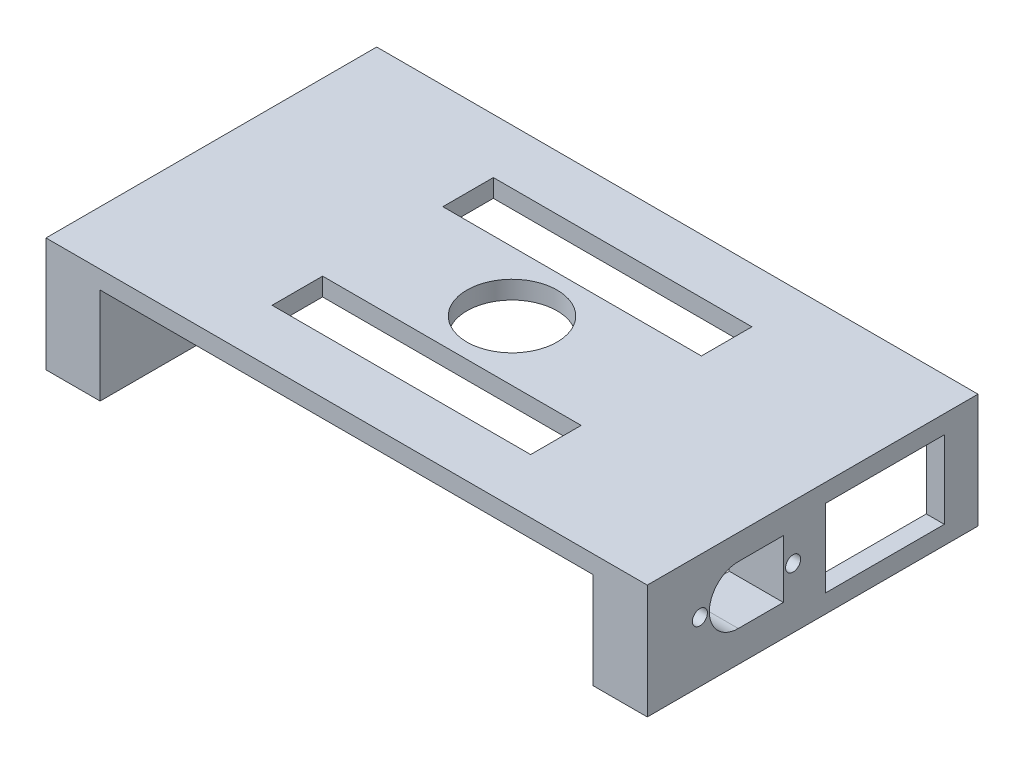
from build123d import *

# Parameters (mm, degrees)
SKETCH1_W           = 100
SKETCH1_H           = 55
BOSS_EXTRUDE1_DEPTH = 19
SKETCH2_W           = 82
SKETCH2_H           = 91
CUT_EXTRUDE1_DEPTH  = 16
CUT_EXTRUDE3_REACH  = 107.438
SKETCH3_R           = 1.25
CUT_EXTRUDE13_REACH = 107.438
SKETCH15_W          = 19.8
SKETCH15_H          = 12.9
CUT_EXTRUDE14_REACH = 62.144
SKETCH6_R           = 7.5
SKETCH6_W           = 43
SKETCH6_H           = 8.4
SKETCH16_W          = 6
SKETCH16_H          = 27.5
CUT_EXTRUDE15_DEPTH = 16


with BuildPart() as part:
    # Sketch1 → Boss-Extrude1 (new body)
    with BuildSketch(Plane(origin=(0, 0, 0), x_dir=(1, 0, 0), z_dir=(0, 1, 0))):
        Rectangle(SKETCH1_W, SKETCH1_H)
    extrude(amount=BOSS_EXTRUDE1_DEPTH)

    # Sketch2 → Cut-Extrude1 (cut)
    with BuildSketch(Plane.XZ):
        Rectangle(SKETCH2_W, SKETCH2_H)
    extrude(amount=-CUT_EXTRUDE1_DEPTH, mode=Mode.SUBTRACT)

    # Sketch3 → Cut-Extrude3 (cut, up to next)
    with BuildSketch(Plane(origin=(50, 0, 0), x_dir=(0, 0, -1), z_dir=(1, 0, 0)), mode=Mode.PRIVATE) as cut_extrude3_sk1:
        with Locations((-18.75, 10)):
            Circle(SKETCH3_R)
    cut_extrude3_tool1 = extrude(cut_extrude3_sk1.sketch, amount=-CUT_EXTRUDE3_REACH, mode=Mode.PRIVATE) & part.part
    # Sketch3 → Cut-Extrude3 (cut, up to next)
    with BuildSketch(Plane(origin=(50, 0, 0), x_dir=(0, 0, -1), z_dir=(1, 0, 0)), mode=Mode.PRIVATE) as cut_extrude3_sk2:
        with Locations((-3.25, 10)):
            Circle(SKETCH3_R)
    cut_extrude3_tool2 = extrude(cut_extrude3_sk2.sketch, amount=-CUT_EXTRUDE3_REACH, mode=Mode.PRIVATE) & part.part
    # Sketch3 → Cut-Extrude3 (cut, up to next)
    with BuildSketch(Plane(origin=(50, 0, 0), x_dir=(0, 0, -1), z_dir=(1, 0, 0)), mode=Mode.PRIVATE) as cut_extrude3_sk3:
        with BuildLine():
            Line((-4.871818182, 5.185), (-4.871818182, 14.815))
            Line((-4.871818182, 14.815), (-12.367897727, 14.815))
            ThreePointArc((-12.367897727, 14.815), (-17.182897727, 10), (-12.367897727, 5.185))
            Line((-12.367897727, 5.185), (-4.871818182, 5.185))
        make_face()
    cut_extrude3_tool3 = extrude(cut_extrude3_sk3.sketch, amount=-CUT_EXTRUDE3_REACH, mode=Mode.PRIVATE) & part.part
    add(cut_extrude3_tool1.solids().sort_by_distance((50, 10, 18.75))[0], mode=Mode.SUBTRACT)
    add(cut_extrude3_tool2.solids().sort_by_distance((50, 10, 3.25))[0], mode=Mode.SUBTRACT)
    add(cut_extrude3_tool3.solids().sort_by_distance((50, 10, 10.561909))[0], mode=Mode.SUBTRACT)

    # Sketch15 → Cut-Extrude13 (cut, up to next)
    with BuildSketch(Plane(origin=(50, 0, 0), x_dir=(0, 0, -1), z_dir=(1, 0, 0)), mode=Mode.PRIVATE) as cut_extrude13_sk1:
        with Locations((12, 9.5)):
            Rectangle(SKETCH15_W, SKETCH15_H)
    cut_extrude13_tool1 = extrude(cut_extrude13_sk1.sketch, amount=-CUT_EXTRUDE13_REACH, mode=Mode.PRIVATE) & part.part
    add(cut_extrude13_tool1.solids().sort_by_distance((50, 9.5, -12))[0], mode=Mode.SUBTRACT)

    # Sketch6 → Cut-Extrude14 (cut, up to next)
    with BuildSketch(Plane(origin=(0, 19, 0), x_dir=(1, 0, 0), z_dir=(0, 1, 0)), mode=Mode.PRIVATE) as cut_extrude14_sk1:
        Circle(SKETCH6_R)
    cut_extrude14_tool1 = extrude(cut_extrude14_sk1.sketch, amount=-CUT_EXTRUDE14_REACH, mode=Mode.PRIVATE) & part.part
    # Sketch6 → Cut-Extrude14 (cut, up to next)
    with BuildSketch(Plane(origin=(0, 19, 0), x_dir=(1, 0, 0), z_dir=(0, 1, 0)), mode=Mode.PRIVATE) as cut_extrude14_sk2:
        with Locations((0, -14.2)):
            Rectangle(SKETCH6_W, SKETCH6_H)
    cut_extrude14_tool2 = extrude(cut_extrude14_sk2.sketch, amount=-CUT_EXTRUDE14_REACH, mode=Mode.PRIVATE) & part.part
    # Sketch6 → Cut-Extrude14 (cut, up to next)
    with BuildSketch(Plane(origin=(0, 19, 0), x_dir=(1, 0, 0), z_dir=(0, 1, 0)), mode=Mode.PRIVATE) as cut_extrude14_sk3:
        with Locations((0, 14.2)):
            Rectangle(SKETCH6_W, SKETCH6_H)
    cut_extrude14_tool3 = extrude(cut_extrude14_sk3.sketch, amount=-CUT_EXTRUDE14_REACH, mode=Mode.PRIVATE) & part.part
    add(cut_extrude14_tool1.solids().sort_by_distance((0, 19, 0))[0], mode=Mode.SUBTRACT)
    add(cut_extrude14_tool2.solids().sort_by_distance((0, 19, 14.2))[0], mode=Mode.SUBTRACT)
    add(cut_extrude14_tool3.solids().sort_by_distance((0, 19, -14.2))[0], mode=Mode.SUBTRACT)

    # Sketch16 → Cut-Extrude15 (cut)
    with BuildSketch(Plane.XZ):
        with Locations((44, -13.75)):
            Rectangle(SKETCH16_W, SKETCH16_H)
    extrude(amount=-CUT_EXTRUDE15_DEPTH, mode=Mode.SUBTRACT)


solid = part.part
